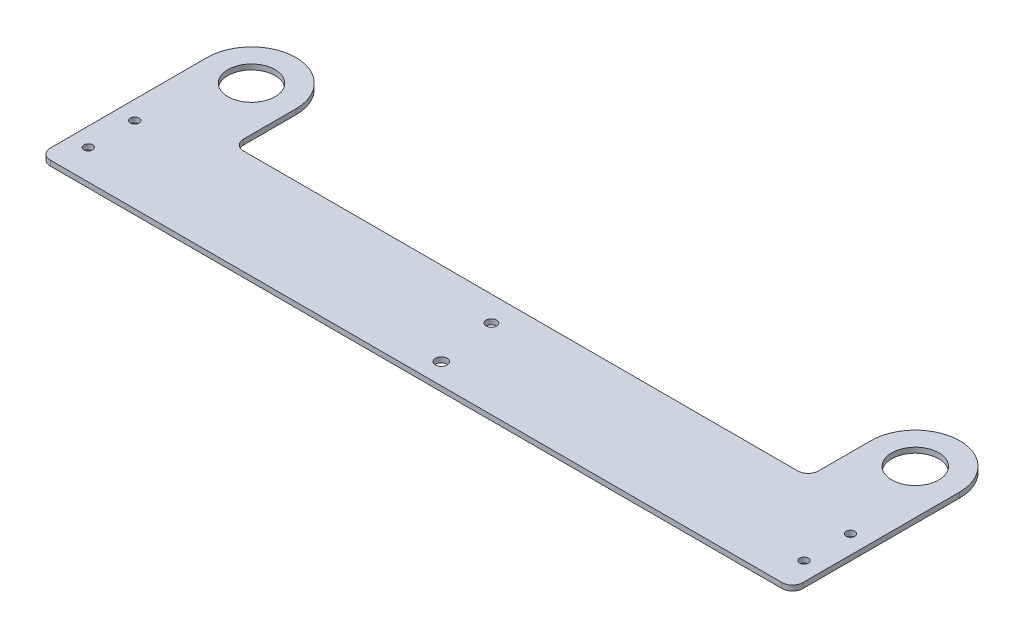
from build123d import *

# Parameters (mm, degrees)
SKETCH1_R           = 14.2875
BOSS_EXTRUDE1_DEPTH = 3.175
CUT_EXTRUDE1_REACH  = 444.058
SKETCH2_R           = 3.556
SKETCH2_R_2         = 3.175
CUT_EXTRUDE2_REACH  = 444.058
SKETCH3_R           = 2.667


with BuildPart() as part:
    # Sketch1 → Boss-Extrude1 (new body)
    with BuildSketch(Plane(origin=(0, 0, 0), x_dir=(1, 0, 0), z_dir=(0, 1, 0))):
        with BuildLine():
            Line((-26.9875, 0), (-26.9875, -95.25))
            ThreePointArc((-26.9875, -95.25), (-25.127628061, -99.740128061), (-20.6375, -101.6))
            Line((-20.6375, -101.6), (423.8625, -101.6))
            ThreePointArc((423.8625, -101.6), (428.352628061, -99.740128061), (430.2125, -95.25))
            Line((430.2125, -95.25), (430.2125, 0))
            ThreePointArc((430.2125, 0), (403.225, 26.9875), (376.2375, 0))
            Line((376.2375, 0), (376.2375, -31.75))
            ThreePointArc((376.2375, -31.75), (374.377628061, -36.240128061), (369.8875, -38.1))
            Line((369.8875, -38.1), (33.3375, -38.1))
            ThreePointArc((33.3375, -38.1), (28.847371939, -36.240128061), (26.9875, -31.75))
            Line((26.9875, -31.75), (26.9875, 0))
            ThreePointArc((26.9875, 0), (0, 26.9875), (-26.9875, 0))
        make_face()
        Circle(SKETCH1_R, mode=Mode.SUBTRACT)
        with Locations((403.225, 0)):
            Circle(SKETCH1_R, mode=Mode.SUBTRACT)
    extrude(amount=BOSS_EXTRUDE1_DEPTH)

    # Sketch2 → Cut-Extrude1 (cut, up to next)
    with BuildSketch(Plane(origin=(0, 3.175, 0), x_dir=(1, 0, 0), z_dir=(0, 1, 0)), mode=Mode.PRIVATE) as cut_extrude1_sk1:
        with Locations((204.1525, -88.9)):
            Circle(SKETCH2_R)
    cut_extrude1_tool1 = extrude(cut_extrude1_sk1.sketch, amount=-CUT_EXTRUDE1_REACH, mode=Mode.PRIVATE) & part.part
    # Sketch2 → Cut-Extrude1 (cut, up to next)
    with BuildSketch(Plane(origin=(0, 3.175, 0), x_dir=(1, 0, 0), z_dir=(0, 1, 0)), mode=Mode.PRIVATE) as cut_extrude1_sk2:
        with Locations((199.0725, -53.34)):
            Circle(SKETCH2_R_2)
    cut_extrude1_tool2 = extrude(cut_extrude1_sk2.sketch, amount=-CUT_EXTRUDE1_REACH, mode=Mode.PRIVATE) & part.part
    add(cut_extrude1_tool1.solids().sort_by_distance((204.1525, 3.175, 88.9))[0], mode=Mode.SUBTRACT)
    add(cut_extrude1_tool2.solids().sort_by_distance((199.0725, 3.175, 53.34))[0], mode=Mode.SUBTRACT)

    # Sketch3 → Cut-Extrude2 (cut, up to next)
    with BuildSketch(Plane(origin=(0, 3.175, 0), x_dir=(1, 0, 0), z_dir=(0, 1, 0)), mode=Mode.PRIVATE) as cut_extrude2_sk1:
        with Locations((-15.779743521, -55.159030044)):
            Circle(SKETCH3_R)
    cut_extrude2_tool1 = extrude(cut_extrude2_sk1.sketch, amount=-CUT_EXTRUDE2_REACH, mode=Mode.PRIVATE) & part.part
    # Sketch3 → Cut-Extrude2 (cut, up to next)
    with BuildSketch(Plane(origin=(0, 3.175, 0), x_dir=(1, 0, 0), z_dir=(0, 1, 0)), mode=Mode.PRIVATE) as cut_extrude2_sk2:
        with Locations((419.004743521, -55.159030044)):
            Circle(SKETCH3_R)
    cut_extrude2_tool2 = extrude(cut_extrude2_sk2.sketch, amount=-CUT_EXTRUDE2_REACH, mode=Mode.PRIVATE) & part.part
    # Sketch3 → Cut-Extrude2 (cut, up to next)
    with BuildSketch(Plane(origin=(0, 3.175, 0), x_dir=(1, 0, 0), z_dir=(0, 1, 0)), mode=Mode.PRIVATE) as cut_extrude2_sk3:
        with Locations((-15.779743521, -83.371493131)):
            Circle(SKETCH3_R)
    cut_extrude2_tool3 = extrude(cut_extrude2_sk3.sketch, amount=-CUT_EXTRUDE2_REACH, mode=Mode.PRIVATE) & part.part
    # Sketch3 → Cut-Extrude2 (cut, up to next)
    with BuildSketch(Plane(origin=(0, 3.175, 0), x_dir=(1, 0, 0), z_dir=(0, 1, 0)), mode=Mode.PRIVATE) as cut_extrude2_sk4:
        with Locations((419.004743521, -83.371493131)):
            Circle(SKETCH3_R)
    cut_extrude2_tool4 = extrude(cut_extrude2_sk4.sketch, amount=-CUT_EXTRUDE2_REACH, mode=Mode.PRIVATE) & part.part
    add(cut_extrude2_tool1.solids().sort_by_distance((-15.779744, 3.175, 55.15903))[0], mode=Mode.SUBTRACT)
    add(cut_extrude2_tool2.solids().sort_by_distance((419.004744, 3.175, 55.15903))[0], mode=Mode.SUBTRACT)
    add(cut_extrude2_tool3.solids().sort_by_distance((-15.779744, 3.175, 83.371493))[0], mode=Mode.SUBTRACT)
    add(cut_extrude2_tool4.solids().sort_by_distance((419.004744, 3.175, 83.371493))[0], mode=Mode.SUBTRACT)


solid = part.part
